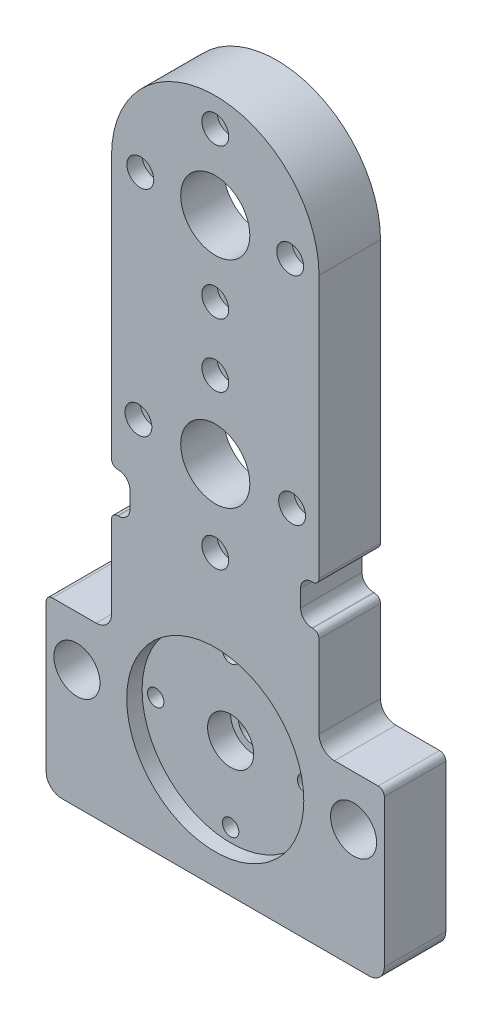
from build123d import *

# Parameters (mm, degrees)
BOLT_CIRCLE_R                                     = 14.2748
BOLT_CIRCLE_R_2                                   = 6.35
BASE_DEPTH                                        = 12.7
STRUCTURE_TUBE_CONNECTION_COUNTERBORE_D           = 6.7564
STRUCTURE_TUBE_CONNECTION_COUNTERBORE_CBORE_D     = 11.1125
STRUCTURE_TUBE_CONNECTION_COUNTERBORE_CBORE_DEPTH = 6.35
STRUCTURE_TUBE_CONNECTION_COUNTERBORE_PA_COUNT    = 4
SPINDLE_CONNECTION_COUNTERBORE_D                  = 6.7564
SPINDLE_CONNECTION_COUNTERBORE_CBORE_D            = 11.1125
SPINDLE_CONNECTION_COUNTERBORE_CBORE_DEPTH        = 6.35
SPINDLE_CONNECTION_COUNTERBORE_PATTERN_COUNT      = 4
SKETCH16_R                                        = 36.576
STRUCTURE_TUBE_MOUNTING_POCKET_DEPTH              = 6.35
SKETCH17_R                                        = 36.576
SPINDLE_MOUNTING_POCKET_DEPTH                     = 7.62
SKETCH18_R                                        = 9.525
LEAD_SCREW_THROUGH_HOLE_DEPTH                     = 9.525
SKETCH20_R                                        = 9.525
RAIL_MOUNTING_PILOT_HOLES_DEPTH                   = 169.702482958
GENERIC_ROUNDING_FILLET_R                         = 6.35
WOOD_SPINDLE_CBORE_D                              = 6.7564
WOOD_SPINDLE_CBORE_CBORE_D                        = 11.1125
WOOD_SPINDLE_CBORE_CBORE_DEPTH                    = 6.35
CIRPATTERN1_COUNT                                 = 4
SKETCH30_R                                        = 36.576
WOOD_SPINDLE_MOUNTING_POCKET_DEPTH                = 7.62
CROSS_SLIDE_CUTOUT_FILLETS_R                      = 4.7625
FILLET2_R                                         = 2.54


with BuildPart() as part:
    # Bolt circle → Base (new, symmetric)
    with BuildSketch(Plane.XY):
        with BuildLine():
            Line((-42.8625, 88.9), (-42.8625, -22.1615))
            Line((-42.8625, -22.1615), (-35.2425, -22.1615))
            Line((-35.2425, -22.1615), (-35.2425, -38.6715))
            Line((-35.2425, -38.6715), (-42.8625, -38.6715))
            Line((-42.8625, -38.6715), (-42.8625, -81.5975))
            Line((-42.8625, -81.5975), (-69.85, -81.5975))
            Line((-69.85, -81.5975), (-69.85, -151.4475))
            Line((-69.85, -151.4475), (69.85, -151.4475))
            Line((69.85, -151.4475), (69.85, -81.5975))
            Line((69.85, -81.5975), (42.8625, -81.5975))
            Line((42.8625, -81.5975), (42.8625, -38.6715))
            Line((42.8625, -38.6715), (35.2425, -38.6715))
            Line((35.2425, -38.6715), (35.2425, -22.1615))
            Line((35.2425, -22.1615), (42.8625, -22.1615))
            Line((42.8625, -22.1615), (42.8625, 88.9))
            ThreePointArc((42.8625, 88.9), (0, 131.7625), (-42.8625, 88.9))
        make_face()
        with Locations((0, 88.9)):
            Circle(BOLT_CIRCLE_R, mode=Mode.SUBTRACT)
        Circle(BOLT_CIRCLE_R, mode=Mode.SUBTRACT)
        with Locations((0, -102.235)):
            Circle(BOLT_CIRCLE_R_2, mode=Mode.SUBTRACT)
    extrude(amount=BASE_DEPTH, both=True)

    # Structure tube connection counterbore (through all)
    with Locations(Plane(origin=(0, 0, -12.7), x_dir=(-1, 0, 0), z_dir=(0, 0, -1))):
        with Locations((0, -71.27875)):
            structure_tube_connection_counterbore = CounterBoreHole(STRUCTURE_TUBE_CONNECTION_COUNTERBORE_D / 2, STRUCTURE_TUBE_CONNECTION_COUNTERBORE_CBORE_D / 2, STRUCTURE_TUBE_CONNECTION_COUNTERBORE_CBORE_DEPTH)

    # Structure tube connection counterbore pattern: Structure tube connection counterbore ×4 about axis
    structure_tube_connection_counterbore_pa_axis = Axis((0, -102.235, 12.7), (0, 0, -1))
    for i in range(1, STRUCTURE_TUBE_CONNECTION_COUNTERBORE_PA_COUNT):
        add(structure_tube_connection_counterbore.rotate(structure_tube_connection_counterbore_pa_axis, i * 360 / STRUCTURE_TUBE_CONNECTION_COUNTERBORE_PA_COUNT), mode=Mode.SUBTRACT)

    # Spindle connection counterbore (through all)
    with Locations(Plane.XY.offset(12.7)):
        with Locations((0, 31.75)):
            spindle_connection_counterbore = CounterBoreHole(SPINDLE_CONNECTION_COUNTERBORE_D / 2, SPINDLE_CONNECTION_COUNTERBORE_CBORE_D / 2, SPINDLE_CONNECTION_COUNTERBORE_CBORE_DEPTH)

    # Spindle connection counterbore pattern: Spindle connection counterbore ×4 about axis
    spindle_connection_counterbore_pattern_axis = Axis((0, 0, 12.7), (0, 0, -1))
    for i in range(1, SPINDLE_CONNECTION_COUNTERBORE_PATTERN_COUNT):
        add(spindle_connection_counterbore.rotate(spindle_connection_counterbore_pattern_axis, i * 360 / SPINDLE_CONNECTION_COUNTERBORE_PATTERN_COUNT), mode=Mode.SUBTRACT)

    # Sketch16 → Structure tube mounting pocket (cut)
    with BuildSketch(Plane.XY.offset(12.7)):
        with Locations((0, -102.235)):
            Circle(SKETCH16_R)
    extrude(amount=-STRUCTURE_TUBE_MOUNTING_POCKET_DEPTH, mode=Mode.SUBTRACT)

    # Sketch17 → Spindle mounting pocket (cut)
    with BuildSketch(Plane(origin=(0, 0, -12.7), x_dir=(-1, 0, 0), z_dir=(0, 0, -1))):
        Circle(SKETCH17_R)
    extrude(amount=-SPINDLE_MOUNTING_POCKET_DEPTH, mode=Mode.SUBTRACT)

    # Sketch18 → Lead screw through hole (cut)
    with BuildSketch(Plane.XY.offset(6.35)):
        with Locations((0, -102.235)):
            Circle(SKETCH18_R)
    extrude(amount=-LEAD_SCREW_THROUGH_HOLE_DEPTH, mode=Mode.SUBTRACT)

    # Sketch20 → Rail mounting pilot_holes (cut, through all)
    with BuildSketch(Plane.XY.offset(12.7)):
        with Locations((57.15, -102.235)):
            Circle(SKETCH20_R)
        with Locations((-57.15, -102.235)):
            Circle(SKETCH20_R)
    extrude(amount=-RAIL_MOUNTING_PILOT_HOLES_DEPTH, mode=Mode.SUBTRACT)

    # Generic_rounding_fillet
    generic_rounding_fillet_edges = [part.edges().sort_by_distance(p)[0] for p in [
        (-69.85, -151.4475, 0),
        (69.85, -151.4475, 0),
        (-42.8625, -81.5975, 0),
        (42.8625, -81.5975, 0),
    ]]
    fillet(generic_rounding_fillet_edges, radius=GENERIC_ROUNDING_FILLET_R)

    # wood_spindle_CBORE (through all)
    with Locations(Plane.XY.offset(12.7)):
        with Locations((0, 119.85625)):
            wood_spindle_cbore = CounterBoreHole(WOOD_SPINDLE_CBORE_D / 2, WOOD_SPINDLE_CBORE_CBORE_D / 2, WOOD_SPINDLE_CBORE_CBORE_DEPTH)

    # CirPattern1: wood_spindle_CBORE ×4 about axis
    cirpattern1_axis = Axis((0, 88.9, 12.7), (0, 0, -1))
    for i in range(1, CIRPATTERN1_COUNT):
        add(wood_spindle_cbore.rotate(cirpattern1_axis, i * 360 / CIRPATTERN1_COUNT), mode=Mode.SUBTRACT)

    # Sketch30 → wood_spindle_mounting_pocket (cut)
    with BuildSketch(Plane(origin=(0, 0, -12.7), x_dir=(-1, 0, 0), z_dir=(0, 0, -1))):
        with Locations((0, 88.9)):
            Circle(SKETCH30_R)
    extrude(amount=-WOOD_SPINDLE_MOUNTING_POCKET_DEPTH, mode=Mode.SUBTRACT)

    # cross_slide_cutout_fillets
    cross_slide_cutout_fillets_edges = [part.edges().sort_by_distance(p)[0] for p in [
        (-35.2425, -38.6715, 0),
        (-35.2425, -22.1615, 0),
        (35.2425, -22.1615, 0),
        (35.2425, -38.6715, 0),
    ]]
    fillet(cross_slide_cutout_fillets_edges, radius=CROSS_SLIDE_CUTOUT_FILLETS_R)

    # Fillet2
    fillet2_edges = [part.edges().sort_by_distance(p)[0] for p in [
        (-42.8625, -22.1615, 0),
        (42.8625, -22.1615, 0),
        (-42.8625, -38.6715, 0),
        (42.8625, -38.6715, 0),
        (69.85, -81.5975, 0),
        (-69.85, -81.5975, 0),
    ]]
    fillet(fillet2_edges, radius=FILLET2_R)


solid = part.part
